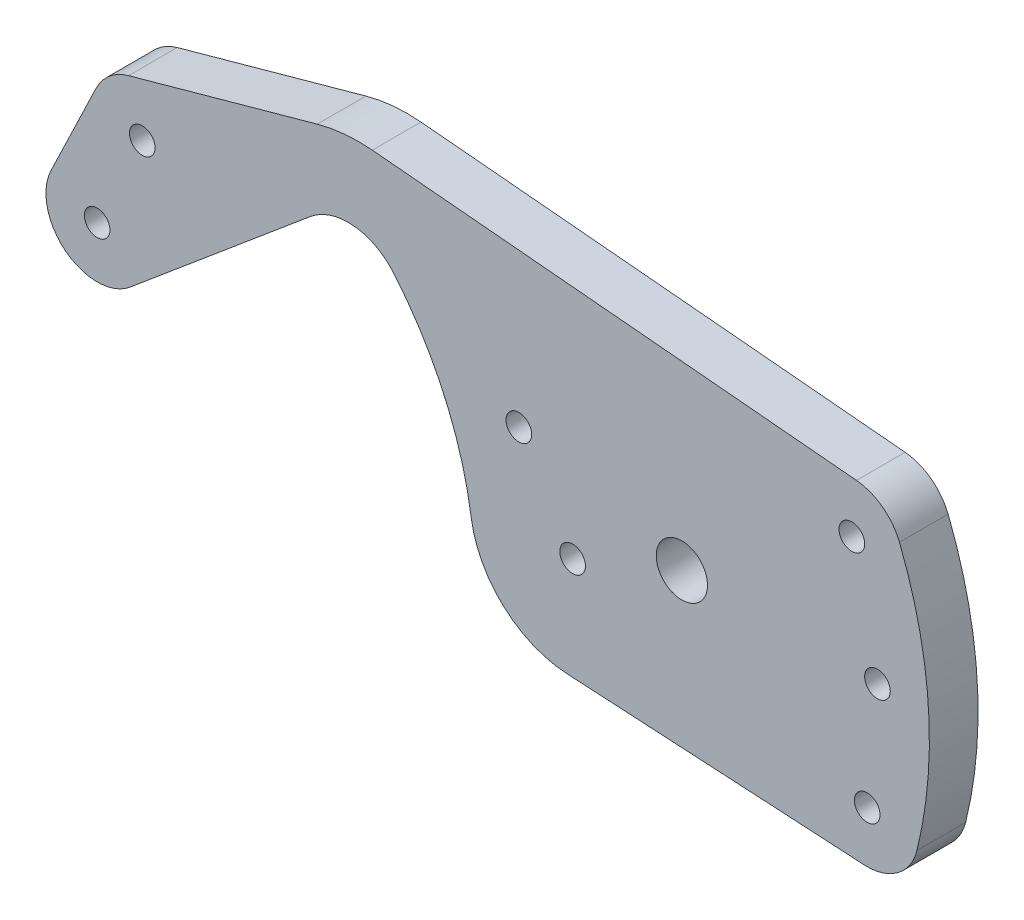
from build123d import *

# Parameters (mm, degrees)
SKETCH1_R           = 2.5
SKETCH1_R_2         = 5
BOSS_EXTRUDE1_DEPTH = 9.5


with BuildPart() as part:
    # Sketch1 → Boss-Extrude1 (new body)
    with BuildSketch(Plane.XY):
        with BuildLine():
            Line((-22.456470733, -28.6731981), (35.613033738, -31.983788338))
            ThreePointArc((35.613033738, -31.983788338), (42.11712535, -30.048408011), (45.888257007, -24.406823948))
            ThreePointArc((45.888257007, -24.406823948), (48.128157677, 1.060560267), (42.475146865, 25.993435805))
            ThreePointArc((42.475146865, 25.993435805), (39.165728798, 30.312340187), (34.084881329, 32.259176594))
            Line((34.084881329, 32.259176594), (-60.421265923, 40.824870599))
            ThreePointArc((-60.421265923, 40.824870599), (-65.828509758, 40.825661271), (-71.148063, 39.855795394))
            Line((-71.148063, 39.855795394), (-107.990717696, 29.636151525))
            ThreePointArc((-107.990717696, 29.636151525), (-111.733722809, 27.670443731), (-114.329936653, 24.333713582))
            Line((-114.329936653, 24.333713582), (-123.129936653, 6.033713582))
            ThreePointArc((-123.129936653, 6.033713582), (-120.252485213, -6.197177966), (-107.689906175, -5.960444431))
            Line((-107.689906175, -5.960444431), (-72.481796123, 23.582667728))
            ThreePointArc((-72.481796123, 23.582667728), (-64.087156165, 26.22948754), (-56.279665087, 22.165164937))
            ThreePointArc((-56.279665087, 22.165164937), (-46.349241416, 6.330059528), (-41.110342939, -11.612008926))
            ThreePointArc((-41.110342939, -11.612008926), (-34.819646644, -23.462280048), (-22.456470733, -28.6731981))
        make_face()
        with Locations((-114.117782272, 1.7)):
            Circle(SKETCH1_R, mode=Mode.SUBTRACT)
        with Locations((36.182217728, -22)):
            Circle(SKETCH1_R, mode=Mode.SUBTRACT)
        with Locations((-21.317782272, -8.7)):
            Circle(SKETCH1_R, mode=Mode.SUBTRACT)
        Circle(SKETCH1_R_2, mode=Mode.SUBTRACT)
        with Locations((38.182217728, -0.1)):
            Circle(SKETCH1_R, mode=Mode.SUBTRACT)
        with Locations((-105.317782272, 20)):
            Circle(SKETCH1_R, mode=Mode.SUBTRACT)
        with Locations((-31.817782272, 8.3)):
            Circle(SKETCH1_R, mode=Mode.SUBTRACT)
        with Locations((33.182217728, 22.3)):
            Circle(SKETCH1_R, mode=Mode.SUBTRACT)
    extrude(amount=BOSS_EXTRUDE1_DEPTH)


solid = part.part
